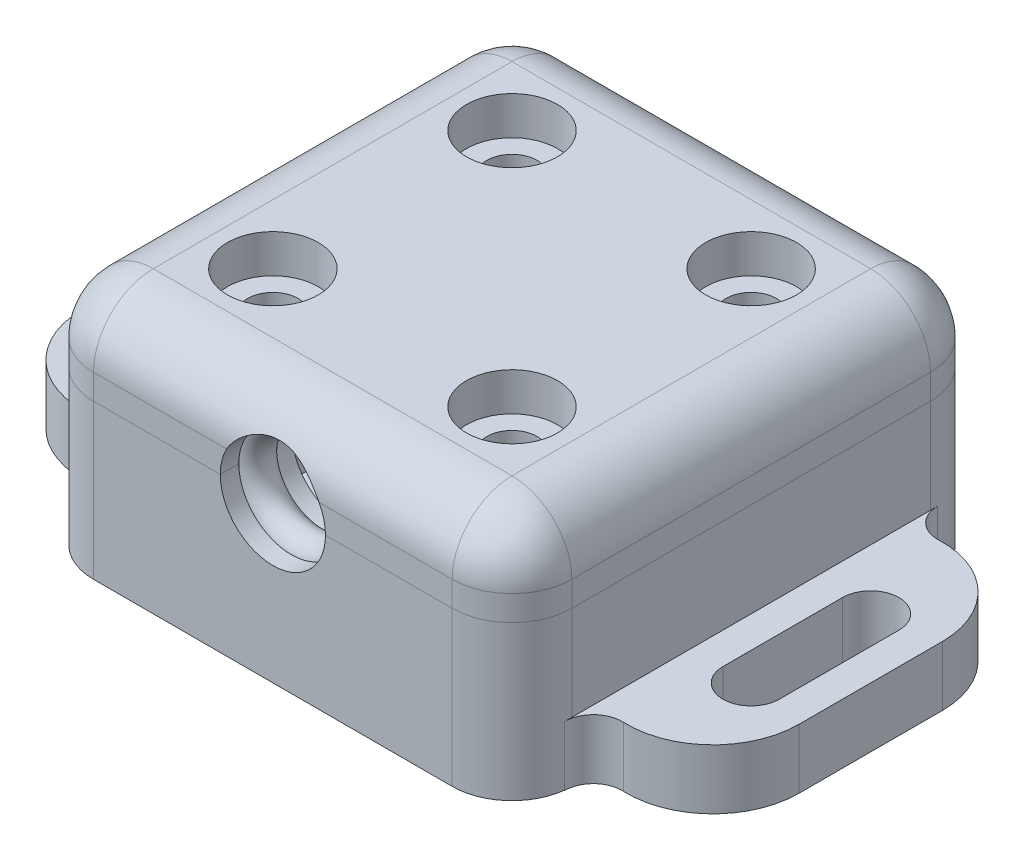
from build123d import *

# Parameters (mm, degrees)
SKETCH1_W                    = 25.39999999999999
SKETCH1_H                    = 25.39999999999999
SKETCH1_W_2                  = 17.779999999999998
SKETCH1_H_2                  = 17.779999999999998
BOSS_EXTRUDE1_DEPTH          = 4.2543
CUT_EXTRUDE1_REACH           = 30.715
SKETCH3_R                    = 2.794
SKETCH2_W                    = 25.399999999999995
SKETCH2_H                    = 25.39999999999999
BOSS_EXTRUDE2_DEPTH          = 3.9370000000000003
SKETCH5_R                    = 0.9525
SKETCH7_R                    = 0.9524999999999983
SKETCH5_2_R                  = 0.9525
SKETCH7_2_R                  = 0.9524999999999983
SKETCH9_W                    = 25.399999999999995
SKETCH9_H                    = 25.39999999999999
BOSS_EXTRUDE3_DEPTH          = 0.254
SKETCH13_W                   = 17.78000000000001
SKETCH13_H                   = 17.779999999999998
BOSS_EXTRUDE5_DEPTH          = 1.6
BOSS_EXTRUDE4_DEPTH          = 5.308599898
SKETCH11_R                   = 1.3334999999999988
SKETCH11_R_2                 = 1.3334999999999997
CUT_EXTRUDE2_DEPTH           = 20.336050264695462
SKETCH12_R                   = 2.4129999999999985
SKETCH12_R_2                 = 2.4130000000000003
CUT_EXTRUDE3_DEPTH           = 2.032
FILLET2_R                    = 3.175
FILLET3_R                    = 3.175
FILLET4_R                    = 0.508
SKETCH11_2_R                 = 1.3334999999999988
CUT_EXTRUDE5_DEPTH           = 4.572
CUT_EXTRUDE5_DRAFT           = 4.000000000000009
CUT_EXTRUDE5_PROFILE_2_DEPTH = 4.572
CUT_EXTRUDE5_PROFILE_2_DRAFT = 4.000000000000009
SKETCH11_2_R_2               = 1.3334999999999997
CUT_EXTRUDE5_PROFILE_3_DEPTH = 4.572
CUT_EXTRUDE5_PROFILE_3_DRAFT = 4.000000000000009
CUT_EXTRUDE5_PROFILE_4_DEPTH = 4.572
CUT_EXTRUDE5_PROFILE_4_DRAFT = 4.000000000000009
FILLET5_R                    = 3.175
BOSS_EXTRUDE6_DEPTH          = 3.175


with BuildPart() as part:
    # Sketch1 → Boss-Extrude1 (new body)
    with BuildSketch(Plane(origin=(0, 0, 0), x_dir=(1, 0, 0), z_dir=(0, 1, 0))):
        Rectangle(SKETCH1_W, SKETCH1_H)
        Rectangle(SKETCH1_W_2, SKETCH1_H_2, mode=Mode.SUBTRACT)
    extrude(amount=BOSS_EXTRUDE1_DEPTH)

    # Sketch3 → Cut-Extrude1 (cut, up to next)
    with BuildSketch(Plane.XY.offset(12.699999999999996), mode=Mode.PRIVATE) as cut_extrude1_sk1:
        with Locations((-6.94e-15, 4.2543)):
            Circle(SKETCH3_R)
    cut_extrude1_tool1 = extrude(cut_extrude1_sk1.sketch, amount=-CUT_EXTRUDE1_REACH, mode=Mode.PRIVATE) & part.part
    add(cut_extrude1_tool1.solids().sort_by_distance((0, 4.2543, 12.7))[0], mode=Mode.SUBTRACT)


with BuildPart() as body_2:
    # Mirror1: mirrored copy
    add(part.part.mirror(Plane(origin=(0, 4.2543, 0), x_dir=(0, 0, 1), z_dir=(0, -1, 0))))


with BuildPart() as part_1:
    add(part.part)

    # Sketch2 → Boss-Extrude2 (add)
    with BuildSketch(Plane.XZ):
        Rectangle(SKETCH2_W, SKETCH2_H)
    extrude(amount=BOSS_EXTRUDE2_DEPTH)


with BuildPart() as cut_sweep2_tool:
    # Cut-Sweep2: sweep along a path in Sketch6
    with BuildLine(Plane(origin=(0, 4.2543, 0), x_dir=(1, 0, 0), z_dir=(0, 1, 0))) as cut_sweep2_path:
        Line((-10.795000000000002, 9.524999999999995), (-10.795, -9.524999999999997))
        ThreePointArc((-10.795, -9.524999999999997), (-10.423025612106915, -10.423025612106912), (-9.525, -10.794999999999998))
        Line((-9.525, -10.794999999999998), (9.524999999999991, -10.794999999999998))
        ThreePointArc((9.524999999999991, -10.794999999999998), (10.423025612106908, -10.423025612106914), (10.794999999999993, -9.524999999999997))
        Line((10.794999999999993, -9.524999999999997), (10.794999999999993, 9.524999999999997))
        ThreePointArc((10.794999999999993, 9.524999999999997), (10.423025612106908, 10.423025612106914), (9.524999999999991, 10.794999999999998))
        Line((9.524999999999991, 10.794999999999998), (-9.525000000000002, 10.794999999999996))
        ThreePointArc((-9.525000000000002, 10.794999999999996), (-10.423025612106919, 10.423025612106912), (-10.795000000000002, 9.524999999999995))
    # Sketch5 → Cut-Sweep2 (sweep)
    with BuildSketch(Plane.ZY.offset(-2.7939999999999925)):
        with Locations((10.794999999999998, 4.2543)):
            Circle(SKETCH5_R)
    sweep(path=cut_sweep2_path.line)


with BuildPart() as part_2:
    add(part_1.part)

    # Cut-Sweep2: cut by cut_sweep2_tool
    add(cut_sweep2_tool.part, mode=Mode.SUBTRACT)


with BuildPart() as body_2_1:
    add(body_2.part)

    # Cut-Sweep2: cut by cut_sweep2_tool
    add(cut_sweep2_tool.part, mode=Mode.SUBTRACT)


with BuildPart() as cut_revolve1_tool:
    # Sketch7 → Cut-Revolve1 (revolve)
    with BuildSketch(Plane(origin=(0, 4.2543, 0), x_dir=(1, 0, 0), z_dir=(0, 1, 0))):
        with Locations((3.0479999999999943, -10.794999999999998)):
            Circle(SKETCH7_R)
    revolve(axis=Axis((-6.94e-15, 4.2543, 8.889999999999999), (0, 0, 1)))


with BuildPart() as part_3:
    add(part_2.part)

    # Cut-Revolve1: cut by cut_revolve1_tool
    add(cut_revolve1_tool.part, mode=Mode.SUBTRACT)


with BuildPart() as body_2_2:
    add(body_2_1.part)

    # Cut-Revolve1: cut by cut_revolve1_tool
    add(cut_revolve1_tool.part, mode=Mode.SUBTRACT)

    # Sketch9 → Boss-Extrude3 (add)
    with BuildSketch(Plane(origin=(0, 8.5086, 0), x_dir=(1, 0, 0), z_dir=(0, 1, 0))):
        Rectangle(SKETCH9_W, SKETCH9_H)
    extrude(amount=BOSS_EXTRUDE3_DEPTH)

    # Sketch13 → Boss-Extrude5 (add)
    with BuildSketch(Plane.XZ.offset(-8.5086)):
        Rectangle(SKETCH13_W, SKETCH13_H)
    extrude(amount=BOSS_EXTRUDE5_DEPTH)

    # Sketch10 → Boss-Extrude4 (add)
    with BuildSketch(Plane.XZ.offset(-6.9086)):
        with BuildLine():
            Line((6.3499999999999925, -3.301999999999998), (8.889999999999993, -3.3019999999999983))
            Line((8.889999999999993, -3.3019999999999983), (8.889999999999993, -8.889999999999995))
            Line((8.889999999999993, -8.889999999999995), (3.3019999999999934, -8.889999999999999))
            Line((3.3019999999999934, -8.889999999999999), (3.3019999999999934, -6.349999999999998))
            ThreePointArc((3.3019999999999934, -6.349999999999998), (4.194738530943396, -4.1947385309434), (6.3499999999999925, -3.301999999999998))
        make_face()
        with BuildLine():
            Line((-8.88999999999999, -8.889999999999997), (-8.889999999999993, -3.302))
            Line((-8.889999999999993, -3.302), (-6.3499999999999925, -3.3019999999999996))
            ThreePointArc((-6.3499999999999925, -3.3019999999999996), (-4.194738530943395, -4.194738530943402), (-3.3019999999999916, -6.349999999999999))
            Line((-3.3019999999999916, -6.349999999999999), (-3.3019999999999907, -8.889999999999999))
            Line((-3.3019999999999907, -8.889999999999999), (-8.88999999999999, -8.889999999999997))
        make_face()
        with BuildLine():
            Line((-6.349999999999992, 3.301999999999998), (-8.889999999999993, 3.3019999999999987))
            Line((-8.889999999999993, 3.3019999999999987), (-8.889999999999995, 8.889999999999997))
            Line((-8.889999999999995, 8.889999999999997), (-3.301999999999994, 8.889999999999999))
            Line((-3.301999999999994, 8.889999999999999), (-3.3019999999999934, 6.349999999999997))
            ThreePointArc((-3.3019999999999934, 6.349999999999997), (-4.194738530943395, 4.194738530943401), (-6.349999999999992, 3.301999999999998))
        make_face()
        with BuildLine():
            Line((8.889999999999992, 8.889999999999999), (8.889999999999993, 3.3020000000000005))
            Line((8.889999999999993, 3.3020000000000005), (6.349999999999992, 3.3019999999999996))
            ThreePointArc((6.349999999999992, 3.3019999999999996), (4.194738530943395, 4.194738530943402), (3.3019999999999916, 6.349999999999998))
            Line((3.3019999999999916, 6.349999999999998), (3.301999999999991, 8.889999999999999))
            Line((3.301999999999991, 8.889999999999999), (8.889999999999992, 8.889999999999999))
        make_face()
    extrude(amount=BOSS_EXTRUDE4_DEPTH)

    # Sketch11 → Cut-Extrude2 (cut, through all)
    with BuildSketch(Plane.XZ.offset(-1.6000001019999999)):
        with Locations(Location((6.349999999999991, 6.35, 0), (0, 0, 270))):
            Circle(SKETCH11_R)
        with Locations(Location((6.349999999999991, -6.35, 0), (0, 0, 90))):
            Circle(SKETCH11_R)
        with Locations(Location((-6.349999999999991, 6.35, 0), (0, 0, 90))):
            Circle(SKETCH11_R_2)
        with Locations(Location((-6.349999999999991, -6.35, 0), (0, 0, 270))):
            Circle(SKETCH11_R_2)
    extrude(amount=-CUT_EXTRUDE2_DEPTH, mode=Mode.SUBTRACT)

    # Sketch12 → Cut-Extrude3 (cut)
    with BuildSketch(Plane(origin=(0, 8.7626, 0), x_dir=(1, 0, 0), z_dir=(0, 1, 0))):
        with Locations(Location((-6.349999999999991, -6.35, 0), (0, 0, 270))):
            Circle(SKETCH12_R)
        with Locations(Location((-6.3499999999999925, 6.349999999999998, 0), (0, 0, 90))):
            Circle(SKETCH12_R)
        with Locations(Location((6.3499999999999925, -6.349999999999998, 0), (0, 0, 90))):
            Circle(SKETCH12_R_2)
        with Locations(Location((6.349999999999991, 6.35, 0), (0, 0, 270))):
            Circle(SKETCH12_R)
    extrude(amount=-CUT_EXTRUDE3_DEPTH, mode=Mode.SUBTRACT)

    # Fillet2
    # the kernel refuses this fillet: 3.175 mm, written as the material it takes off along each edge
    with BuildSketch(Plane(origin=(9.524999999999999, 5.587599999999999, 9.524999999999995), x_dir=(1, 0, 0), z_dir=(0, 0, 1))) as fillet2_piece_1_section:
        Polygon((0, 0), (FILLET2_R, 0), (FILLET2_R, FILLET2_R), (0, FILLET2_R), align=None)
    fillet2_piece_1 = extrude(amount=FILLET2_R, mode=Mode.PRIVATE)
    fillet2_piece_1 = fillet2_piece_1 - Plane(origin=(9.524999999999999, 5.587599999999999, 9.524999999999995), x_dir=(-0.7071067811865475, -0.7071067811865475, 0), z_dir=(0, 0, 1)) * Sphere(FILLET2_R, mode=Mode.PRIVATE)
    add(fillet2_piece_1, mode=Mode.SUBTRACT)
    with BuildSketch(Plane(origin=(-9.524999999999999, 5.587599999999999, 9.524999999999995), x_dir=(0, 1, 0), z_dir=(0, 0, 1))) as fillet2_piece_2_section:
        Polygon((0, 0), (FILLET2_R, 0), (FILLET2_R, FILLET2_R), (0, FILLET2_R), align=None)
    fillet2_piece_2 = extrude(amount=FILLET2_R, mode=Mode.PRIVATE)
    fillet2_piece_2 = fillet2_piece_2 - Plane(origin=(-9.524999999999999, 5.587599999999999, 9.524999999999995), x_dir=(0.7071067811865475, -0.7071067811865475, 0), z_dir=(0, 0, 1)) * Sphere(FILLET2_R, mode=Mode.PRIVATE)
    add(fillet2_piece_2, mode=Mode.SUBTRACT)
    with BuildSketch(Plane(origin=(-9.524999999999999, 5.587599999999999, -9.524999999999999), x_dir=(-1, 0, 0), z_dir=(0, 1, 0))) as fillet2_piece_3_section:
        Polygon((0, 0), (FILLET2_R, 0), (FILLET2_R, -FILLET2_R), (0, -FILLET2_R), align=None)
    fillet2_piece_3 = extrude(amount=FILLET2_R, mode=Mode.PRIVATE)
    fillet2_piece_3 = fillet2_piece_3 - Plane(origin=(-9.524999999999999, 5.587599999999999, -9.524999999999999), x_dir=(0.7071067811865475, 0, 0.7071067811865475), z_dir=(0, 1, 0)) * Sphere(FILLET2_R, mode=Mode.PRIVATE)
    add(fillet2_piece_3, mode=Mode.SUBTRACT)
    with BuildSketch(Plane(origin=(9.524999999999991, 5.587599999999999, -9.524999999999999), x_dir=(0, 1, 0), z_dir=(1, 0, 0))) as fillet2_piece_4_section:
        Polygon((0, 0), (FILLET2_R, 0), (FILLET2_R, -FILLET2_R), (0, -FILLET2_R), align=None)
    fillet2_piece_4 = extrude(amount=FILLET2_R, mode=Mode.PRIVATE)
    fillet2_piece_4 = fillet2_piece_4 - Plane(origin=(9.524999999999991, 5.587599999999999, -9.524999999999999), x_dir=(0, -0.7071067811865475, 0.7071067811865475), z_dir=(1, 0, 0)) * Sphere(FILLET2_R, mode=Mode.PRIVATE)
    add(fillet2_piece_4, mode=Mode.SUBTRACT)
    with BuildSketch(Plane(origin=(12.699999999999992, -3.683200000000003, 12.699999999999996), x_dir=(-1, 1.18e-15, 0), z_dir=(1.18e-15, 1, 0))) as fillet2_piece_5:
        with BuildLine():
            CenterArc((FILLET2_R, -FILLET2_R), FILLET2_R, 90, 89.99999999999997)
            Line((-3.55e-15, -FILLET2_R), (0, 0))
            Line((0, 0), (FILLET2_R, 0))
        make_face()
    extrude(amount=9.270800000000001, mode=Mode.SUBTRACT)
    with BuildSketch(Plane(origin=(-12.7, 5.587599999999999, 12.699999999999996), x_dir=(1, 0, 0), z_dir=(0, -1, 0))) as fillet2_piece_6:
        with BuildLine():
            CenterArc((FILLET2_R, -FILLET2_R), FILLET2_R, 90, 90)
            Line((0, -FILLET2_R), (0, 0))
            Line((0, 0), (FILLET2_R, 0))
        make_face()
    extrude(amount=9.270800000000001, mode=Mode.SUBTRACT)
    with BuildSketch(Plane(origin=(-12.7, 5.587599999999999, -12.7), x_dir=(0, -3.9e-16, 1), z_dir=(0, -1, -3.9e-16))) as fillet2_piece_7:
        with BuildLine():
            CenterArc((FILLET2_R, -FILLET2_R), FILLET2_R, 90, 89.99999999999994)
            Line((0, -FILLET2_R), (0, 0))
            Line((0, 0), (FILLET2_R, 0))
        make_face()
    extrude(amount=9.270799999999998, mode=Mode.SUBTRACT)
    with BuildSketch(Plane(origin=(12.699999999999992, -3.683200000000003, -12.7), x_dir=(0, -3.9e-16, 1), z_dir=(1.18e-15, 1, 3.9e-16))) as fillet2_piece_8:
        with BuildLine():
            CenterArc((FILLET2_R, -FILLET2_R), FILLET2_R, 90, 89.99999999999997)
            Line((0, -FILLET2_R), (0, 0))
            Line((0, 0), (FILLET2_R, 0))
        make_face()
    extrude(amount=9.270800000000001, mode=Mode.SUBTRACT)
    with BuildSketch(Plane(origin=(-12.7, 8.762599999999999, -9.524999999999999), x_dir=(1, 0, 0), z_dir=(0, 0, 1))) as fillet2_piece_9:
        with BuildLine():
            CenterArc((FILLET2_R, -FILLET2_R), FILLET2_R, 90, 90)
            Line((0, -FILLET2_R), (0, 0))
            Line((0, 0), (FILLET2_R, 0))
        make_face()
    extrude(amount=19.049999999999997, mode=Mode.SUBTRACT)
    with BuildSketch(Plane(origin=(-9.524999999999999, 8.762599999999999, 12.699999999999996), x_dir=(0, -1, 0), z_dir=(1, 0, 0))) as fillet2_piece_10:
        with BuildLine():
            CenterArc((FILLET2_R, FILLET2_R), FILLET2_R, 180.00000000000003, 90)
            Line((0, FILLET2_R), (0, 0))
            Line((0, 0), (FILLET2_R, 0))
        make_face()
    extrude(amount=19.049999999999997, mode=Mode.SUBTRACT)
    with BuildSketch(Plane(origin=(12.699999999999998, 8.762599999999999, 9.524999999999995), x_dir=(-1.68e-15, -1, 0), z_dir=(0, 0, -1))) as fillet2_piece_11:
        with BuildLine():
            CenterArc((FILLET2_R, FILLET2_R), FILLET2_R, 180.00000000000003, 89.99999999999989)
            Line((5.33e-15, FILLET2_R), (0, 0))
            Line((0, 0), (FILLET2_R, 0))
        make_face()
    extrude(amount=19.049999999999994, mode=Mode.SUBTRACT)
    with BuildSketch(Plane(origin=(9.524999999999991, 8.762599999999999, -12.699999999999998), x_dir=(0, 0, 1), z_dir=(-1, 0, 0))) as fillet2_piece_12:
        with BuildLine():
            CenterArc((FILLET2_R, -FILLET2_R), FILLET2_R, 90, 90)
            Line((-1.78e-15, -FILLET2_R), (0, 0))
            Line((0, 0), (FILLET2_R, 0))
        make_face()
    extrude(amount=19.04999999999999, mode=Mode.SUBTRACT)

    # Fillet3
    # the kernel refuses this fillet: 3.175 mm, written as the material it adds along each edge
    with BuildSketch(Plane(origin=(3.3019999999999934, 6.9086, -8.889999999999999), x_dir=(-1, 0, 0), z_dir=(0, 0, 1)), Plane(origin=(6.3499999999999925, 6.9086, -3.301999999999998), x_dir=(1.7e-16, 0, 1), z_dir=(1, 0, -1.7e-16)), Plane(origin=(-8.889999999999993, 6.9086, -3.302), x_dir=(-1.7e-16, 0, 1), z_dir=(1, 0, 1.7e-16)), Plane(origin=(3.3019999999999916, 6.9086, 6.349999999999998), x_dir=(-1, 0, -1.7e-16), z_dir=(-1.7e-16, 0, 1))) as fillet3_piece_1:
        with BuildLine():
            CenterArc((FILLET3_R, FILLET3_R), FILLET3_R, 180, 90)
            Line((-4.4e-16, FILLET3_R), (0, 0))
            Line((0, 0), (FILLET3_R, 0))
        make_face()
    extrude(amount=2.540000000000001)
    with BuildSketch(Plane(origin=(6.349999999999991, 6.9086, -6.349999999999996), x_dir=(-1, 0, -5.8e-16), z_dir=(5.8e-16, 0, -1))) as fillet3_piece_2:
        with BuildLine():
            CenterArc((3.047999999999998 + FILLET3_R, -FILLET3_R), FILLET3_R, 90, 90)
            Line((3.0479999999999974, -FILLET3_R), (3.047999999999998, 0))
            Line((3.047999999999998, 0), (3.047999999999998 + FILLET3_R, 0))
        make_face()
    revolve(axis=Axis((6.349999999999991, 6.9086, -6.349999999999996), (0, 1, 0)), revolution_arc=90.00000000000007)
    with BuildSketch(Plane(origin=(-3.3019999999999916, 6.9086, -6.349999999999999), x_dir=(1, 0, 3.5e-16), z_dir=(3.5e-16, 0, -1))) as fillet3_piece_3:
        with BuildLine():
            CenterArc((FILLET3_R, FILLET3_R), FILLET3_R, 180, 90)
            Line((-4.4e-16, FILLET3_R), (0, 0))
            Line((0, 0), (FILLET3_R, 0))
        make_face()
    extrude(amount=2.54)
    with BuildSketch(Plane(origin=(-6.3499999999999925, 6.9086, -6.35), x_dir=(0, 0, 1), z_dir=(-1, 0, 0))) as fillet3_piece_4:
        with BuildLine():
            CenterArc((3.0480000000000005 + FILLET3_R, -FILLET3_R), FILLET3_R, 90, 90)
            Line((3.048, -FILLET3_R), (3.0480000000000005, 0))
            Line((3.0480000000000005, 0), (3.0480000000000005 + FILLET3_R, 0))
        make_face()
    revolve(axis=Axis((-6.3499999999999925, 6.9086, -6.35), (0, 1, 0)), revolution_arc=89.99999999999999)
    with BuildSketch(Plane(origin=(-6.349999999999992, 6.9086, 3.301999999999998), x_dir=(-3.5e-16, 0, -1), z_dir=(-1, 0, 3.5e-16)), Plane(origin=(-3.301999999999994, 6.9086, 8.889999999999999), x_dir=(1, 0, 1.7e-16), z_dir=(1.7e-16, 0, -1)), Plane(origin=(8.889999999999993, 6.9086, 3.3020000000000005), x_dir=(3.5e-16, 0, -1), z_dir=(-1, 0, -3.5e-16))) as fillet3_piece_5:
        with BuildLine():
            CenterArc((FILLET3_R, FILLET3_R), FILLET3_R, 180, 90)
            Line((-4.4e-16, FILLET3_R), (0, 0))
            Line((0, 0), (FILLET3_R, 0))
        make_face()
    extrude(amount=2.540000000000002)
    with BuildSketch(Plane(origin=(-6.3499999999999925, 6.9086, 6.349999999999996), x_dir=(1, 0, 2.9e-16), z_dir=(-2.9e-16, 0, 1))) as fillet3_piece_6:
        with BuildLine():
            CenterArc((3.0479999999999987 + FILLET3_R, -FILLET3_R), FILLET3_R, 90, 90)
            Line((3.0479999999999983, -FILLET3_R), (3.0479999999999987, 0))
            Line((3.0479999999999987, 0), (3.0479999999999987 + FILLET3_R, 0))
        make_face()
    revolve(axis=Axis((-6.3499999999999925, 6.9086, 6.349999999999996), (0, 1, 0)), revolution_arc=90)
    with BuildSketch(Plane(origin=(6.349999999999991, 6.9086, 6.35), x_dir=(2.9e-16, 0, -1), z_dir=(1, 0, 2.9e-16))) as fillet3_piece_7:
        with BuildLine():
            CenterArc((3.0479999999999996 + FILLET3_R, -FILLET3_R), FILLET3_R, 90, 90)
            Line((3.047999999999999, -FILLET3_R), (3.0479999999999996, 0))
            Line((3.0479999999999996, 0), (3.0479999999999996 + FILLET3_R, 0))
        make_face()
    revolve(axis=Axis((6.349999999999991, 6.9086, 6.35), (0, 1, 0)), revolution_arc=89.99999999999999)

    # Fillet4
    fillet4_edges = [body_2_2.edges().sort_by_distance(p)[0] for p in [
        (6.095999999999993, 1.600000102, -8.889999999999997),
        (8.889999999999993, 1.600000102, -6.0959999999999965),
        (-8.889999999999992, 1.600000102, -6.095999999999998),
        (-6.09599999999999, 1.600000102, -8.889999999999997),
        (-6.095999999999995, 1.600000102, 8.889999999999997),
        (-8.889999999999993, 1.600000102, 6.095999999999998),
        (6.095999999999991, 1.600000102, 8.889999999999999),
        (8.889999999999993, 1.600000102, 6.096),
    ]]
    fillet(fillet4_edges, radius=FILLET4_R)


with BuildPart() as body_3:
    # Sweep1: sweep along a path in Sketch4
    with BuildLine(Plane(origin=(0, 4.2543, 0), x_dir=(1, 0, 0), z_dir=(0, 1, 0))) as sweep1_path:
        Line((2.7939999999999925, -10.794999999999998), (9.524999999999991, -10.794999999999998))
        ThreePointArc((9.524999999999991, -10.794999999999998), (10.423025612106908, -10.423025612106914), (10.794999999999993, -9.524999999999997))
        Line((10.794999999999993, -9.524999999999997), (10.794999999999993, 9.524999999999997))
        ThreePointArc((10.794999999999993, 9.524999999999997), (10.423025612106908, 10.423025612106914), (9.524999999999991, 10.794999999999998))
        Line((9.524999999999991, 10.794999999999998), (-9.525000000000002, 10.794999999999996))
        ThreePointArc((-9.525000000000002, 10.794999999999996), (-10.423025612106919, 10.423025612106912), (-10.795000000000002, 9.524999999999995))
        Line((-10.795000000000002, 9.524999999999995), (-10.795, -9.524999999999997))
        ThreePointArc((-10.795, -9.524999999999997), (-10.423025612106915, -10.423025612106912), (-9.525, -10.794999999999998))
        Line((-9.525, -10.794999999999998), (-2.7940000000000063, -10.794999999999998))
    # Sketch5<2> → Sweep1 (sweep)
    with BuildSketch(Plane.ZY.offset(-2.7939999999999925)):
        with Locations((10.794999999999998, 4.2543)):
            Circle(SKETCH5_2_R)
    sweep(path=sweep1_path.line)

    # Sketch7<2> → Revolve1 (revolve)
    with BuildSketch(Plane(origin=(0, 4.2543, 0), x_dir=(1, 0, 0), z_dir=(0, 1, 0)), mode=Mode.PRIVATE) as revolve1_sk:
        with Locations((3.0479999999999943, -10.794999999999998)):
            Circle(SKETCH7_2_R)
    revolve(revolve1_sk.sketch.rotate(Axis((-6.94e-15, 4.2543, 8.889999999999999), (0, 0, 1)), 270), axis=Axis((-6.94e-15, 4.2543, 8.889999999999999), (0, 0, 1)))


with BuildPart() as cut_extrude5_tool:
    # Sketch11<2> → Cut-Extrude5 (with draft: the straight prism first)
    with BuildSketch(Plane.XZ.offset(-1.6000001019999999)):
        with Locations(Location((6.349999999999991, 6.35, 0), (0, 0, 270))):
            Circle(SKETCH11_2_R)
    extrude(amount=CUT_EXTRUDE5_DEPTH)
    # Cut-Extrude5: the draft: its side faces are tilted about the plane it starts from
    cut_extrude5_sides = [cut_extrude5_tool.faces().sort_by_distance(p)[0] for p in [
        (6.35, -0.685999898, 7.6835),
    ]]
    draft(cut_extrude5_sides, Plane.XZ.offset(-1.6000001019999999), CUT_EXTRUDE5_DRAFT)


with BuildPart() as part_4:
    add(part_3.part)

    # Cut-Extrude5: cut by cut_extrude5_tool
    add(cut_extrude5_tool.part, mode=Mode.SUBTRACT)


with BuildPart() as cut_extrude5_profile_2_tool:
    # Sketch11<2> → Cut-Extrude5 profile 2 (with draft: the straight prism first)
    with BuildSketch(Plane.XZ.offset(-1.6000001019999999)):
        with Locations(Location((6.349999999999991, -6.35, 0), (0, 0, 90))):
            Circle(SKETCH11_2_R)
    extrude(amount=CUT_EXTRUDE5_PROFILE_2_DEPTH)
    # Cut-Extrude5 profile 2: the draft: its side faces are tilted about the plane it starts from
    cut_extrude5_profile_2_sides = [cut_extrude5_profile_2_tool.faces().sort_by_distance(p)[0] for p in [
        (6.35, -0.685999898, -7.6835),
    ]]
    draft(cut_extrude5_profile_2_sides, Plane.XZ.offset(-1.6000001019999999), CUT_EXTRUDE5_PROFILE_2_DRAFT)


with BuildPart() as part_5:
    add(part_4.part)

    # Cut-Extrude5 profile 2: cut by cut_extrude5_profile_2_tool
    add(cut_extrude5_profile_2_tool.part, mode=Mode.SUBTRACT)


with BuildPart() as cut_extrude5_profile_3_tool:
    # Sketch11<2> → Cut-Extrude5 profile 3 (with draft: the straight prism first)
    with BuildSketch(Plane.XZ.offset(-1.6000001019999999)):
        with Locations(Location((-6.349999999999991, 6.35, 0), (0, 0, 90))):
            Circle(SKETCH11_2_R_2)
    extrude(amount=CUT_EXTRUDE5_PROFILE_3_DEPTH)
    # Cut-Extrude5 profile 3: the draft: its side faces are tilted about the plane it starts from
    cut_extrude5_profile_3_sides = [cut_extrude5_profile_3_tool.faces().sort_by_distance(p)[0] for p in [
        (-6.35, -0.685999898, 5.0165),
    ]]
    draft(cut_extrude5_profile_3_sides, Plane.XZ.offset(-1.6000001019999999), CUT_EXTRUDE5_PROFILE_3_DRAFT)


with BuildPart() as part_6:
    add(part_5.part)

    # Cut-Extrude5 profile 3: cut by cut_extrude5_profile_3_tool
    add(cut_extrude5_profile_3_tool.part, mode=Mode.SUBTRACT)


with BuildPart() as cut_extrude5_profile_4_tool:
    # Sketch11<2> → Cut-Extrude5 profile 4 (with draft: the straight prism first)
    with BuildSketch(Plane.XZ.offset(-1.6000001019999999)):
        with Locations(Location((-6.349999999999991, -6.35, 0), (0, 0, 270))):
            Circle(SKETCH11_2_R_2)
    extrude(amount=CUT_EXTRUDE5_PROFILE_4_DEPTH)
    # Cut-Extrude5 profile 4: the draft: its side faces are tilted about the plane it starts from
    cut_extrude5_profile_4_sides = [cut_extrude5_profile_4_tool.faces().sort_by_distance(p)[0] for p in [
        (-6.35, -0.685999898, -5.0165),
    ]]
    draft(cut_extrude5_profile_4_sides, Plane.XZ.offset(-1.6000001019999999), CUT_EXTRUDE5_PROFILE_4_DRAFT)


with BuildPart() as part_7:
    add(part_6.part)

    # Cut-Extrude5 profile 4: cut by cut_extrude5_profile_4_tool
    add(cut_extrude5_profile_4_tool.part, mode=Mode.SUBTRACT)

    # Fillet5
    fillet5_edges = [part_7.edges().sort_by_distance(p)[0] for p in [
        (12.699999999999996, 0.15864999999999974, 12.699999999999996),
        (-12.7, 0.15864999999999974, 12.699999999999996),
        (-12.7, 0.15864999999999974, -12.699999999999998),
        (12.699999999999996, 0.15864999999999974, -12.699999999999998),
    ]]
    fillet(fillet5_edges, radius=FILLET5_R)

    # Sketch14 → Boss-Extrude6 (add)
    # profile 1 of 2: a face of its own
    with BuildSketch(Plane.XZ.offset(3.9370000000000003)):
        with BuildLine():
            Line((12.699999999999998, 9.900706034607152), (12.699999999999998, -9.900706034607152))
            ThreePointArc((12.699999999999998, -9.900706034607152), (13.169058769409402, -8.800853771800917), (14.287499999999996, -8.378029525955364))
            ThreePointArc((14.287499999999996, -8.378029525955364), (17.642823691771785, -7.109556788418712), (19.05, -3.8099999999999996))
            Line((19.05, -3.8099999999999996), (19.05, 3.8099999999999996))
            ThreePointArc((19.05, 3.8099999999999996), (17.642823691771785, 7.109556788418712), (14.287499999999996, 8.378029525955364))
            ThreePointArc((14.287499999999996, 8.378029525955364), (13.169058769409402, 8.800853771800917), (12.699999999999998, 9.900706034607152))
        make_face()
        with BuildLine():
            Line((17.375, 3.175), (17.375, -3.175))
            ThreePointArc((17.375, -3.175), (15.875, -4.675000000000002), (14.374999999999998, -3.1750000000000003))
            Line((14.374999999999998, -3.1750000000000003), (14.374999999999998, 3.1750000000000003))
            ThreePointArc((14.374999999999998, 3.1750000000000003), (15.875, 4.675), (17.375, 3.175))
        make_face(mode=Mode.SUBTRACT)
    # profile 2 of 2: a face of its own
    with BuildSketch(Plane.XZ.offset(3.9370000000000003)):
        with BuildLine():
            Line((-19.05, -3.8099999999999996), (-19.05, 3.8099999999999996))
            ThreePointArc((-19.05, 3.8099999999999996), (-17.642823691771785, 7.109556788418712), (-14.287499999999996, 8.378029525955364))
            ThreePointArc((-14.287499999999996, 8.378029525955364), (-13.169058769409402, 8.800853771800917), (-12.699999999999998, 9.900706034607152))
            Line((-12.699999999999998, 9.900706034607152), (-12.699999999999998, -9.900706034607152))
            ThreePointArc((-12.699999999999998, -9.900706034607152), (-13.169058769409402, -8.800853771800917), (-14.287499999999996, -8.378029525955364))
            ThreePointArc((-14.287499999999996, -8.378029525955364), (-17.642823691771785, -7.109556788418712), (-19.05, -3.8099999999999996))
        make_face()
        with BuildLine():
            Line((-17.375, 3.175), (-17.375, -3.175))
            ThreePointArc((-17.375, -3.175), (-15.875, -4.675000000000002), (-14.374999999999998, -3.1750000000000003))
            Line((-14.374999999999998, -3.1750000000000003), (-14.374999999999998, 3.1750000000000003))
            ThreePointArc((-14.374999999999998, 3.1750000000000003), (-15.875, 4.675), (-17.375, 3.175))
        make_face(mode=Mode.SUBTRACT)
    extrude(amount=-BOSS_EXTRUDE6_DEPTH)


solid = Compound([body_2_2.part, body_3.part, part_7.part])
